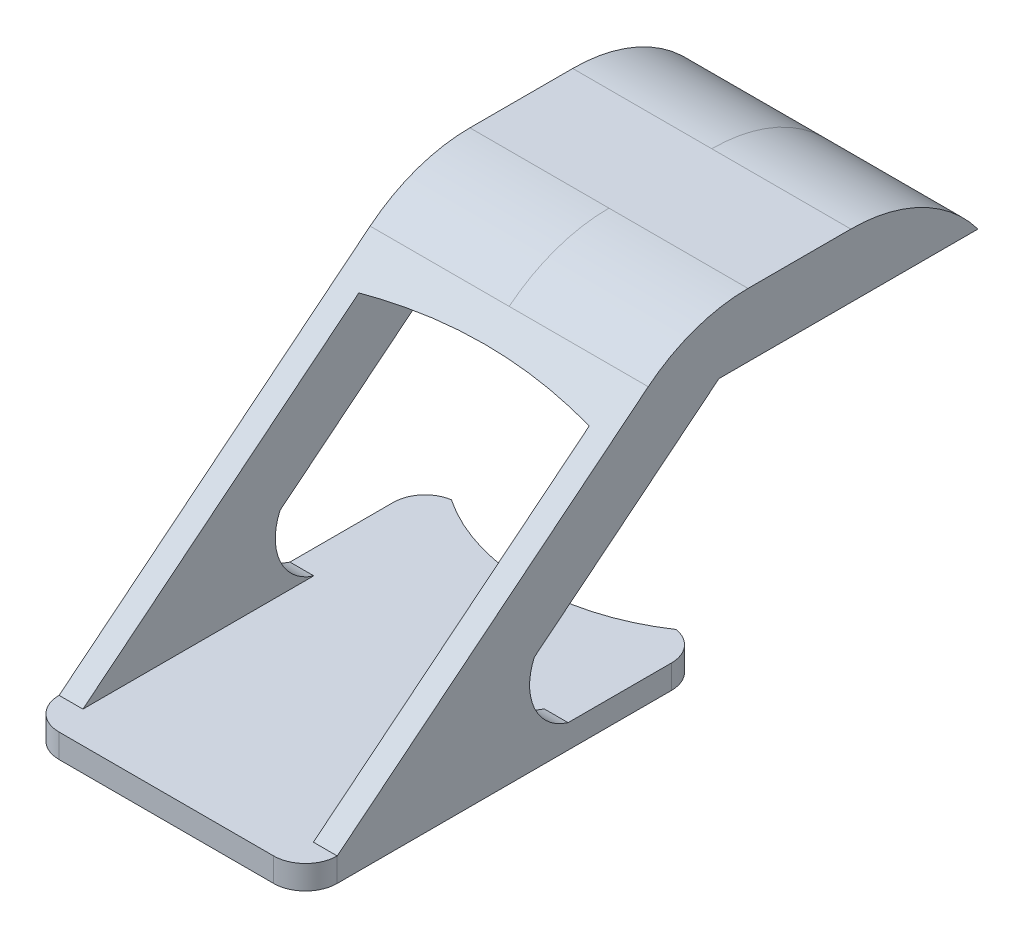
from build123d import *
from build123d.topology import SkipClean

# Parameters (mm, degrees)
BOSS_EXTRUDE4_DEPTH    = 1.5
FILLET1_R              = 2
BOSS_EXTRUDE5_DEPTH    = 8.75
FILLET4_R              = 10
FILLET5_R              = 10
FILLET4_OF_MIRROR2_R   = 10
FILLET5_OF_MIRROR2_R   = 10
CUT_EXTRUDE2_START     = -26.018483
CUT_EXTRUDE2_OUTLINE_W = 14.5
CUT_EXTRUDE2_OUTLINE_H = 14
CUT_EXTRUDE2_DEPTH     = 24.018483
CUT_EXTRUDE3_DEPTH     = 48.40824


# Read off the part's stored shape, not the designer's step: Cut-Extrude2
with BuildPart() as part:
    # Sketch1 → Boss-Extrude4 (new body)
    with BuildSketch(Plane(origin=(0, 0, 0), x_dir=(1, 0, 0), z_dir=(0, 1, 0))):
        with BuildLine():
            Line((-7.070184, 12.5), (-8.75, 12.5))
            Line((-8.75, 12.5), (-8.75, -12.5))
            Line((-8.75, -12.5), (8.75, -12.5))
            Line((8.75, -12.5), (8.75, 12.5))
            Line((8.75, 12.5), (7.070184, 12.5))
            ThreePointArc((7.070184, 12.5), (0, 10.35), (-7.070184, 12.5))
        make_face()
    extrude(amount=BOSS_EXTRUDE4_DEPTH)

    # Fillet1
    # the kernel refuses this fillet: 2 mm, written as the material it takes off along each edge
    with BuildSketch(Plane(origin=(-8.75, -4.935511, -12.5), x_dir=(1, 0, 0), z_dir=(0, 1, 0))) as fillet1_piece_1:
        with BuildLine():
            CenterArc((2, -1.974204), FILLET1_R, 99.212233, 80.787767)
            Line((0, -1.974204), (-0.04, -1.974204))
            Line((-0.04, -1.974204), (-0.04, 0))
            Line((-0.04, 0), (0, 0.04))
            ThreePointArc((0, 0.04), (0.839908, 0.04), (1.673412, 0.039484))
            Line((1.673412, 0.039484), (1.679816, 0))
        make_face()
    extrude(amount=11.371021, mode=Mode.SUBTRACT)
    with BuildSketch(Plane(origin=(8.75, -4.935511, -12.5), x_dir=(0, 0, 1), z_dir=(0, 1, 0))) as fillet1_piece_2:
        with BuildLine():
            CenterArc((1.974204, -2), FILLET1_R, 90, 80.787767)
            Line((0, -1.679816), (-0.039484, -1.673412))
            ThreePointArc((-0.039484, -1.673412), (-0.04, -0.839908), (-0.04, 0))
            Line((-0.04, 0), (0, 0.04))
            Line((0, 0.04), (1.974204, 0.04))
            Line((1.974204, 0.04), (1.974204, 0))
        make_face()
    extrude(amount=11.371021, mode=Mode.SUBTRACT)
    with BuildSketch(Plane(origin=(-8.75, -5, 12.5), x_dir=(0, 0, -1), z_dir=(0, 1, 0)), Plane(origin=(8.75, -5, 12.5), x_dir=(-1, 0, 0), z_dir=(0, 1, 0))) as fillet1_piece_3:
        with BuildLine():
            CenterArc((FILLET1_R, -FILLET1_R), FILLET1_R, 90, 90)
            Line((0, -FILLET1_R), (-FILLET1_R * 0.02, -FILLET1_R))
            Line((-FILLET1_R * 0.02, -FILLET1_R), (-FILLET1_R * 0.02, FILLET1_R * 0.02))
            Line((-FILLET1_R * 0.02, FILLET1_R * 0.02), (FILLET1_R, FILLET1_R * 0.02))
            Line((FILLET1_R, FILLET1_R * 0.02), (FILLET1_R, 0))
        make_face()
    extrude(amount=11.5, mode=Mode.SUBTRACT)

    # Sketch2 → Boss-Extrude5 (add)
    with BuildSketch(Plane(origin=(8.75, 0, 0), x_dir=(0, 0, -1), z_dir=(1, 0, 0))):
        with BuildLine():
            Line((-10.5, 1.5), (11.817003, 19.5))
            Line((11.817003, 19.5), (29.817003, 19.5))
            Line((29.817003, 19.5), (29.817003, 15.5))
            Line((29.817003, 15.5), (13.518483, 15.5))
            Line((13.518483, 15.5), (1.89958, 6.128658))
            ThreePointArc((1.89958, 6.128658), (1.912979, 3.332502), (4.024993, 1.5))
            Line((4.024993, 1.5), (-1.921972, 1.5))
            Line((-1.921972, 1.5), (-10.5, 1.5))
        make_face()
    boss_extrude5 = extrude(amount=-BOSS_EXTRUDE5_DEPTH)

    # Fillet4
    # the kernel refuses this fillet: 10 mm, written as the material it takes off along each edge
    with BuildSketch(Plane(origin=(28.75, 19.5, -29.817003), x_dir=(0, 0, 1), z_dir=(-1, 0, 0))) as fillet4_piece_1:
        with BuildLine():
            CenterArc((8, -10), FILLET4_R, 90, 53.130102)
            Line((0, -4), (-0.16, -3.88))
            ThreePointArc((-0.16, -3.88), (-0.2, -2), (-0.2, 0))
            Line((-0.2, 0), (0, 0.2))
            Line((0, 0.2), (8, 0.2))
            Line((8, 0.2), (8, 0))
        make_face()
    extrude(amount=48.75, mode=Mode.SUBTRACT)

    # Fillet5
    fillet5_edges = [part.edges().sort_by_distance(p)[0] for p in [
        (4.375, 19.5, -11.817003),
    ]]
    fillet(fillet5_edges, radius=FILLET5_R)

    # Mirror2: Boss-Extrude5 across plane
    add(boss_extrude5.mirror(Plane(origin=(0, 0, 0), x_dir=(0, 0, 1), z_dir=(1, 0, 0))))

    # Fillet4 of Mirror2
    # the kernel refuses this fillet: 10 mm, written as the material it takes off along each edge
    with BuildSketch(Plane(origin=(-28.75, 19.5, -29.817003), x_dir=(0, -1, 0), z_dir=(1, 0, 0))) as fillet4_of_mirror2_piece_1:
        with BuildLine():
            CenterArc((10, -8), FILLET4_OF_MIRROR2_R, 126.869898, 53.130102)
            Line((0, -8), (-0.2, -8))
            Line((-0.2, -8), (-0.2, 0))
            Line((-0.2, 0), (0, 0.2))
            ThreePointArc((0, 0.2), (2, 0.2), (3.88, 0.16))
            Line((3.88, 0.16), (4, 0))
        make_face()
    extrude(amount=48.75, mode=Mode.SUBTRACT)

    # Fillet5 of Mirror2
    fillet5_of_mirror2_edges = [part.edges().sort_by_distance(p)[0] for p in [
        (-4.375, 19.5, -11.817003),
    ]]
    fillet(fillet5_of_mirror2_edges, radius=FILLET5_OF_MIRROR2_R)

    # Cut-Extrude2 outline → Cut-Extrude2 (cut)
    with SkipClean():  # the faces are left unmerged after this step: merging them gives an invalid solid
        with BuildSketch(Plane.XY.offset(12.5).offset(CUT_EXTRUDE2_START)):
            with Locations((0, 8.5)):
                Rectangle(CUT_EXTRUDE2_OUTLINE_W, CUT_EXTRUDE2_OUTLINE_H)
        extrude(amount=CUT_EXTRUDE2_DEPTH, mode=Mode.SUBTRACT)

    # Sketch5 → Cut-Extrude3 (cut, through all)
    with SkipClean():  # the faces are left unmerged after this step: merging them gives an invalid solid
        with BuildSketch(Plane.XY.offset(12.5)):
            with BuildLine():
                Line((-7.25, 15.5), (7.25, 15.5))
                add(Edge.make_bspline(
                    [(7.25, 15.5), (0, 16.542635), (-7.25, 15.5)],
                    knots=[0, 0, 0, 1, 1, 1], degree=2))
            make_face()
        extrude(amount=-CUT_EXTRUDE3_DEPTH, mode=Mode.SUBTRACT)


solid = part.part
